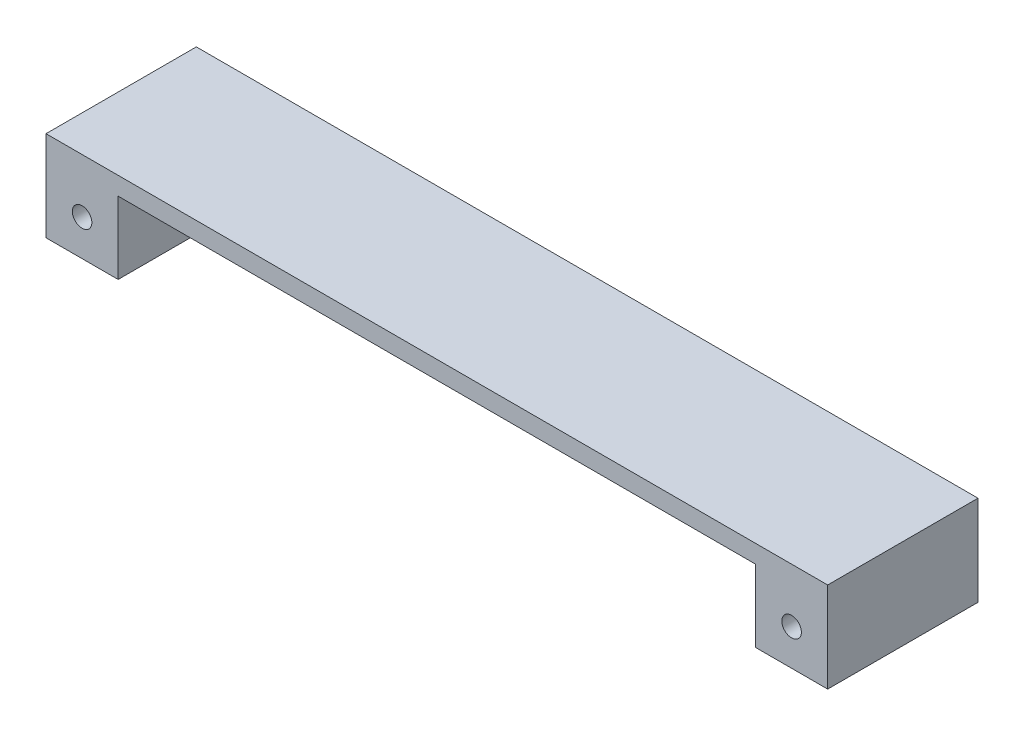
from build123d import *

# Parameters (mm, degrees)
SKETCH1_W           = 130
SKETCH1_H           = 25
BOSS_EXTRUDE1_DEPTH = 3
SKETCH2_W           = 12
SKETCH2_H           = 25
BOSS_EXTRUDE2_DEPTH = 12
SKETCH4_R           = 1.625
CUT_EXTRUDE1_DEPTH  = 133.924790765


with BuildPart() as part:
    # Sketch1 → Boss-Extrude1 (new body)
    with BuildSketch(Plane(origin=(0, 0, 0), x_dir=(1, 0, 0), z_dir=(0, 1, 0))):
        with Locations((65, 12.5)):
            Rectangle(SKETCH1_W, SKETCH1_H)
    extrude(amount=BOSS_EXTRUDE1_DEPTH)

    # Sketch2 → Boss-Extrude2 (add)
    with BuildSketch(Plane.XZ):
        with Locations((6, -12.5)):
            Rectangle(SKETCH2_W, SKETCH2_H)
        with Locations((124, -12.5)):
            Rectangle(SKETCH2_W, SKETCH2_H)
    extrude(amount=BOSS_EXTRUDE2_DEPTH)

    # Sketch4 → Cut-Extrude1 (cut, through all)
    with BuildSketch(Plane.XY):
        with Locations((6, -6)):
            Circle(SKETCH4_R)
        with Locations((124, -6)):
            Circle(SKETCH4_R)
    extrude(amount=-CUT_EXTRUDE1_DEPTH, mode=Mode.SUBTRACT)


solid = part.part
